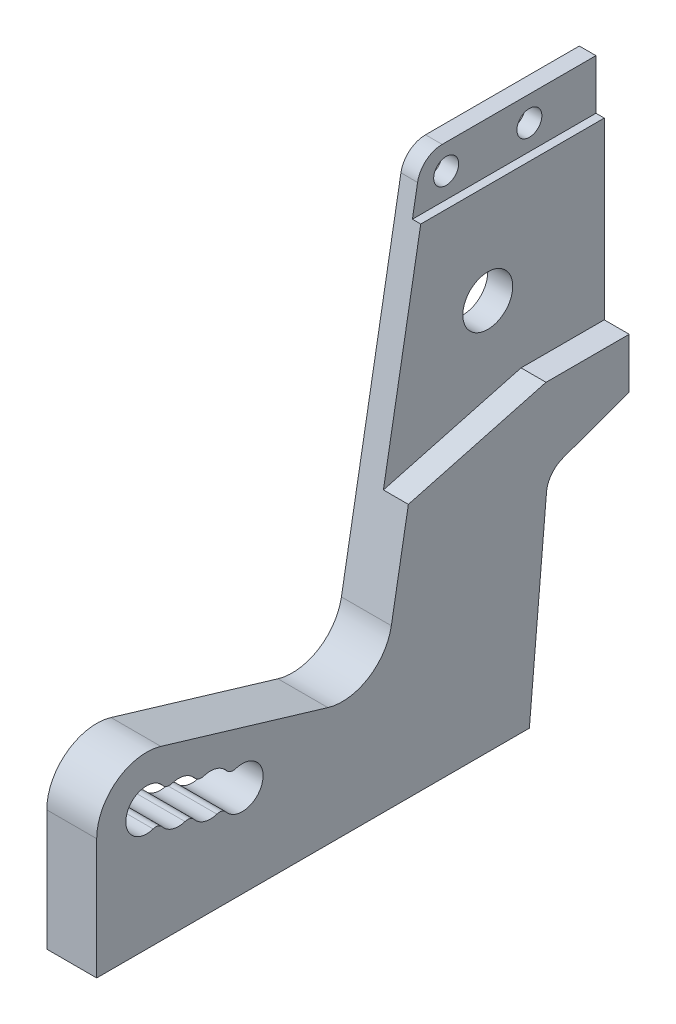
from build123d import *

# Parameters (mm, degrees)
SKETCH1_W                   = 64
SKETCH1_H                   = 62
SKETCH1_R                   = 2.5
SKETCH1_R_2                 = 3
BOSS_EXTRUDE1_DEPTH         = 6
CUT_EXTRUDE2_REACH          = 91.308
FILLET2_R                   = 3
TAP_DRILL_FOR_M3_TAP1_D     = 2.5
TAP_DRILL_FOR_M3_TAP1_DEPTH = 9
TAP_DRILL_FOR_M3_TAP1_TIP   = 0.751075774
CUT_EXTRUDE3_DEPTH          = 8
CUT_EXTRUDE4_DEPTH          = 3
FILLET3_R                   = 3
CUT_EXTRUDE5_REACH          = 91.157
SKETCH14_R                  = 1.5
CUT_EXTRUDE6_REACH          = 91.308
SKETCH15_R                  = 2.5
LPATTERN3_COUNT             = 3
LPATTERN3_PITCH             = 4
FILLET4_R                   = 1
SKETCH16_W                  = 22.057961884
SKETCH16_H                  = 6
CUT_EXTRUDE7_DEPTH          = 1


with BuildPart() as part:
    # Sketch1 → Boss-Extrude1 (new body)
    with BuildSketch(Plane(origin=(0, 0, 0), x_dir=(0, 0, -1), z_dir=(1, 0, 0))):
        with Locations((32, 31)):
            Rectangle(SKETCH1_W, SKETCH1_H)
        with Locations((6, 14.5)):
            Circle(SKETCH1_R, mode=Mode.SUBTRACT)
        with Locations((50, 44)):
            Circle(SKETCH1_R_2, mode=Mode.SUBTRACT)
    extrude(amount=BOSS_EXTRUDE1_DEPTH)

    # Sketch3 → Cut-Extrude2 (cut, up to next)
    with BuildSketch(Plane(origin=(6, 0, 0), x_dir=(0, 0, -1), z_dir=(1, 0, 0)), mode=Mode.PRIVATE) as cut_extrude2_sk1:
        Polygon((64, 0), (52, 0), (54.225932994, 25.442530542), (64, 29), align=None)
    cut_extrude2_tool1 = extrude(cut_extrude2_sk1.sketch, amount=-CUT_EXTRUDE2_REACH, mode=Mode.PRIVATE) & part.part
    add(cut_extrude2_tool1.solids().sort_by_distance((6, 13.1347, -58.667711))[0], mode=Mode.SUBTRACT)

    # Fillet2
    fillet2_edges = [part.edges().sort_by_distance(p)[0] for p in [
        (3, 25.442530542, -54.225932994),
    ]]
    fillet(fillet2_edges, radius=FILLET2_R)

    # Tap Drill for M3 Tap1
    with Locations(Plane(origin=(0, 0, 0), x_dir=(-1, 0, 0), z_dir=(0, -1, 0))):
        with Locations((-3, 48), (-3, 12)):
            Hole(TAP_DRILL_FOR_M3_TAP1_D / 2, depth=TAP_DRILL_FOR_M3_TAP1_DEPTH)
            with Locations((0, 0, -(TAP_DRILL_FOR_M3_TAP1_DEPTH + TAP_DRILL_FOR_M3_TAP1_TIP / 2))):  # 118° drill point
                Cone(0, TAP_DRILL_FOR_M3_TAP1_D / 2, TAP_DRILL_FOR_M3_TAP1_TIP, mode=Mode.SUBTRACT)

    # Sketch9 → Cut-Extrude3 (cut)
    with BuildSketch(Plane(origin=(6, 0, 0), x_dir=(0, 0, -1), z_dir=(1, 0, 0))):
        with BuildLine():
            Line((7.718264205, 20.248701429), (27.783442934, 14.251298571))
            ThreePointArc((27.783442934, 14.251298571), (32.652701535, 14.894000165), (35.410553657, 18.958110934))
            Line((35.410553657, 18.958110934), (43, 62))
            Line((43, 62), (0, 62))
            Line((0, 62), (0, 14.5))
            ThreePointArc((0, 14.5), (2.415978881, 19.311942707), (7.718264205, 20.248701429))
        make_face()
    extrude(amount=-CUT_EXTRUDE3_DEPTH, mode=Mode.SUBTRACT)

    # Sketch13 → Cut-Extrude4 (cut)
    with BuildSketch(Plane(origin=(6, 0, 0), x_dir=(0, 0, -1), z_dir=(1, 0, 0))):
        Polygon((54, 35), (64, 35), (64, 62), (43, 62), (37.457598082, 30.567476765), align=None)
    extrude(amount=-CUT_EXTRUDE4_DEPTH, mode=Mode.SUBTRACT)

    # Fillet3
    fillet3_edges = [part.edges().sort_by_distance(p)[0] for p in [
        (1.5, 62, -43),
    ]]
    fillet(fillet3_edges, radius=FILLET3_R)

    # Sketch14 → Cut-Extrude5 (cut, up to next)
    with BuildSketch(Plane(origin=(3, 0, 0), x_dir=(0, 0, -1), z_dir=(1, 0, 0)), mode=Mode.PRIVATE) as cut_extrude5_sk1:
        with Locations((56, 59)):
            Circle(SKETCH14_R)
    cut_extrude5_tool1 = extrude(cut_extrude5_sk1.sketch, amount=-CUT_EXTRUDE5_REACH, mode=Mode.PRIVATE) & part.part
    # Sketch14 → Cut-Extrude5 (cut, up to next)
    with BuildSketch(Plane(origin=(3, 0, 0), x_dir=(0, 0, -1), z_dir=(1, 0, 0)), mode=Mode.PRIVATE) as cut_extrude5_sk2:
        with Locations((46, 59)):
            Circle(SKETCH14_R)
    cut_extrude5_tool2 = extrude(cut_extrude5_sk2.sketch, amount=-CUT_EXTRUDE5_REACH, mode=Mode.PRIVATE) & part.part
    add(cut_extrude5_tool1.solids().sort_by_distance((3, 59, -56))[0], mode=Mode.SUBTRACT)
    add(cut_extrude5_tool2.solids().sort_by_distance((3, 59, -46))[0], mode=Mode.SUBTRACT)

    # Sketch15 → Cut-Extrude6 (cut, up to next)
    with BuildSketch(Plane.ZY, mode=Mode.PRIVATE) as cut_extrude6_sk1:
        with Locations((-9.832467619, 13.35449053)):
            Circle(SKETCH15_R)
    cut_extrude6_tool1 = extrude(cut_extrude6_sk1.sketch, amount=-CUT_EXTRUDE6_REACH, mode=Mode.PRIVATE) & part.part
    cut_extrude6 = cut_extrude6_tool1.solids().sort_by_distance((0, 13.354491, -9.832468))[0]
    add(cut_extrude6, mode=Mode.SUBTRACT)

    # LPattern3: Cut-Extrude6 ×3
    with Locations(*[Vector(0, -0.28637736754813403, -0.9581169048483599) * (i * LPATTERN3_PITCH) for i in range(1, LPATTERN3_COUNT)]):
        add(cut_extrude6, mode=Mode.SUBTRACT)

    # Fillet4
    fillet4_edges = [part.edges().sort_by_distance(p)[0] for p in [
        (3, 12.490069908, -7.486667758),
        (3, 11.344560437, -11.319135378),
        (3, 10.199050967, -15.151602997),
        (3, 13.073401682, -16.0107351),
        (3, 14.218911152, -12.17826748),
        (3, 15.364420622, -8.345799861),
    ]]
    fillet(fillet4_edges, radius=FILLET4_R)

    # Sketch16 → Cut-Extrude7 (cut)
    with BuildSketch(Plane(origin=(3, 0, 0), x_dir=(0, 0, -1), z_dir=(1, 0, 0))):
        with Locations((52.971019058, 59)):
            Rectangle(SKETCH16_W, SKETCH16_H)
    extrude(amount=-CUT_EXTRUDE7_DEPTH, mode=Mode.SUBTRACT)


solid = part.part
